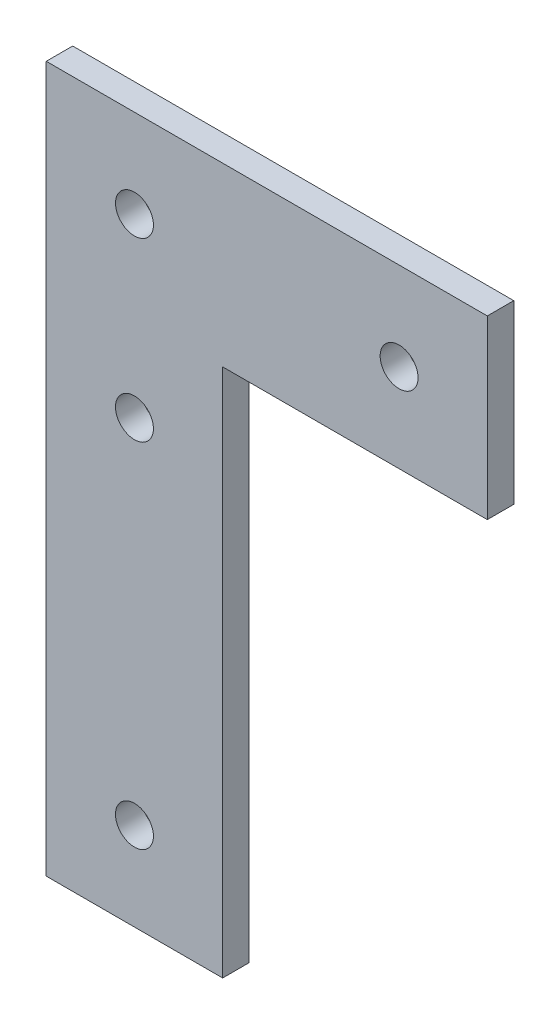
from build123d import *

# Parameters (mm, degrees)
SKETCH1_R      = 2.15
EXTRUDE1_DEPTH = 3


with BuildPart() as part:
    # Sketch1 → Extrude1 (new body)
    with BuildSketch(Plane.XY):
        Polygon((-290.61212976, 147.905049365), (-340.61212976, 147.905049365), (-340.61212976, 127.905049365), (-340.61212976, 67.905049365), (-320.61212976, 67.905049365), (-320.61212976, 127.905049365), (-290.61212976, 127.905049365), align=None)
        with Locations((-330.61212976, 77.905049365)):
            Circle(SKETCH1_R, mode=Mode.SUBTRACT)
        with Locations((-330.61212976, 117.905049365)):
            Circle(SKETCH1_R, mode=Mode.SUBTRACT)
        with Locations((-330.61212976, 137.905049365)):
            Circle(SKETCH1_R, mode=Mode.SUBTRACT)
        with Locations((-300.61212976, 137.905049365)):
            Circle(SKETCH1_R, mode=Mode.SUBTRACT)
    extrude(amount=EXTRUDE1_DEPTH)


solid = part.part
